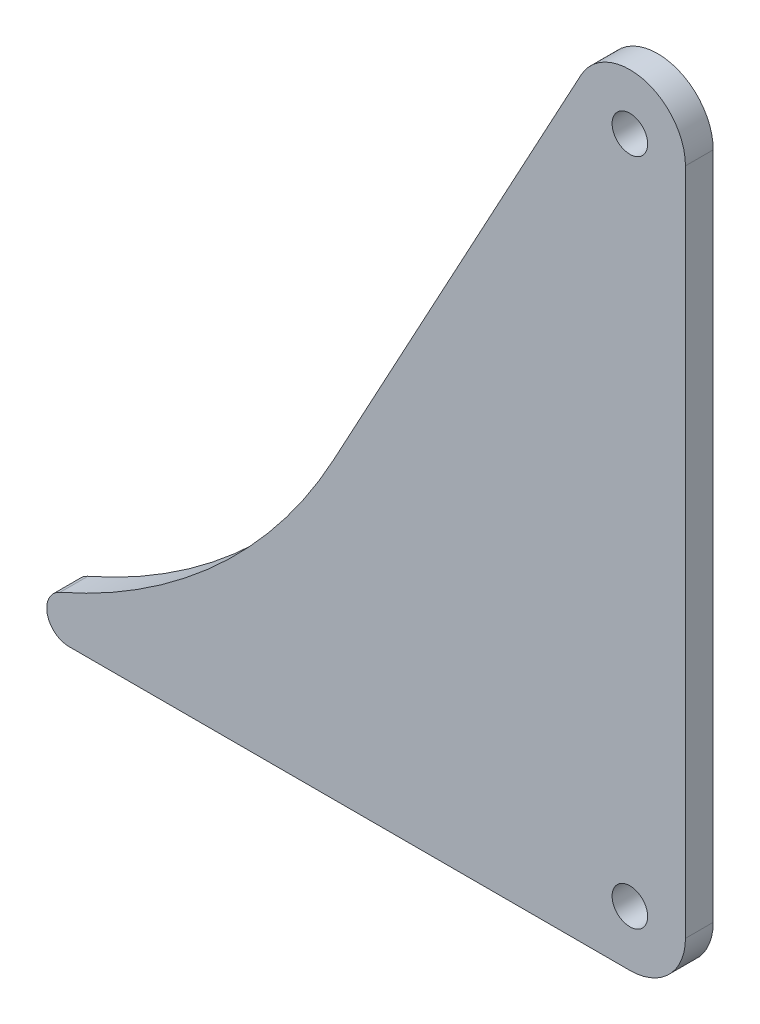
from build123d import *

# Parameters (mm, degrees)
BOSS_EXTRUDE1_DEPTH = 3.175
FILLET1_R           = 2.54
FILLET2_R           = 6.35
SKETCH2_R           = 2.032
CUT_EXTRUDE1_DEPTH  = 116.259869192


with BuildPart() as part:
    # Sketch1 → Boss-Extrude1 (new body)
    with BuildSketch(Plane.XY):
        with BuildLine():
            Line((0, 0), (0, 107.862454899))
            Line((0, 107.862454899), (-40.236247909, 33.556337388))
            ThreePointArc((-40.236247909, 33.556337388), (-60.543702682, 10.941910796), (-88.9, 0))
            Line((-88.9, 0), (0, 0))
        make_face()
    extrude(amount=BOSS_EXTRUDE1_DEPTH)

    # Fillet1
    fillet1_edges = [part.edges().sort_by_distance(p)[0] for p in [
        (-88.9, 0, 1.5875),
    ]]
    fillet(fillet1_edges, radius=FILLET1_R)

    # Fillet2
    fillet2_edges = [part.edges().sort_by_distance(p)[0] for p in [
        (0, 0, 1.5875),
        (0, 107.862454899, 1.5875),
    ]]
    fillet(fillet2_edges, radius=FILLET2_R)

    # Sketch2 → Cut-Extrude1 (cut, through all)
    with BuildSketch(Plane.XY.offset(3.175)):
        with Locations((-6.35, 6.35)):
            Circle(SKETCH2_R)
        with Locations((-6.35, 82.7999097)):
            Circle(SKETCH2_R)
    extrude(amount=-CUT_EXTRUDE1_DEPTH, mode=Mode.SUBTRACT)


solid = part.part
